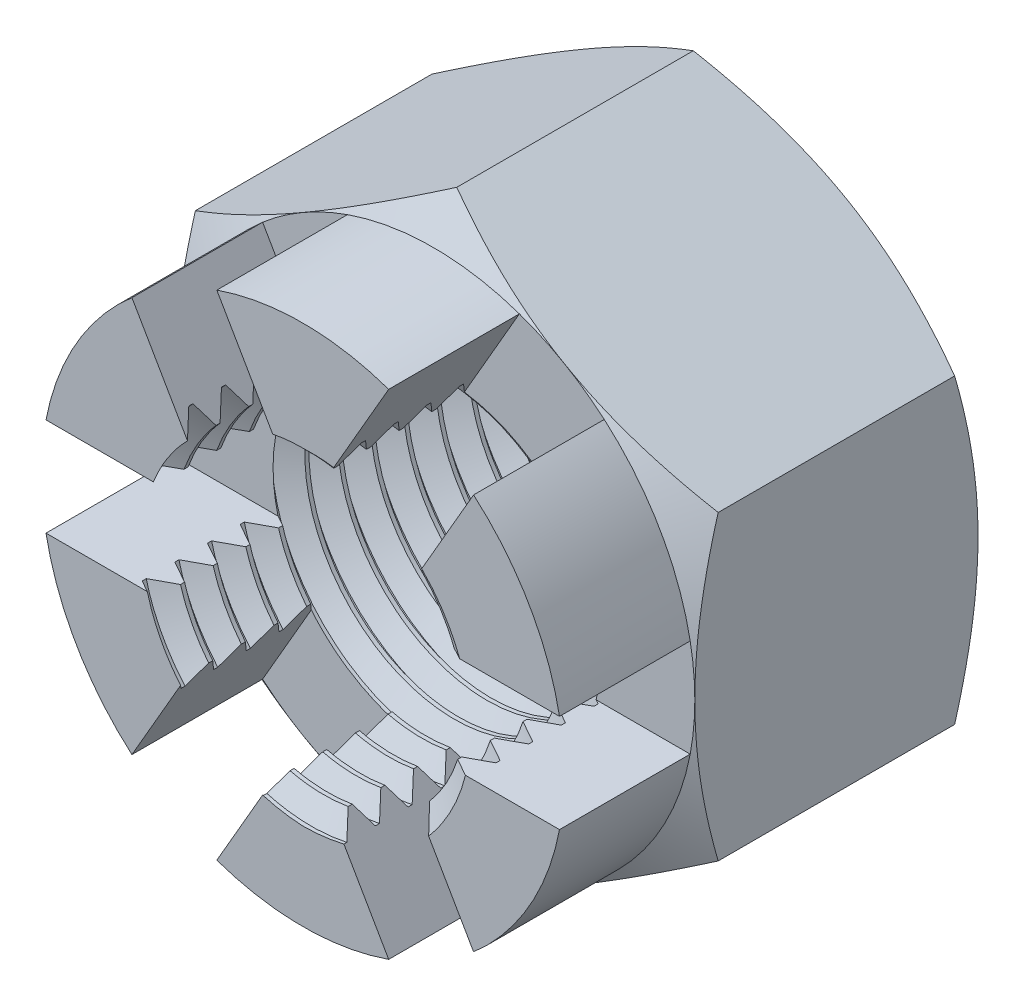
from build123d import *

# Parameters (mm, degrees)
EXTRUDE1_DEPTH      = 19
SKETCH3_OUTSIDE_W   = 129.178
SKETCH3_OUTSIDE_H   = 132.89
SKETCH3_OUTSIDE_R   = 12
CUT_EXTRUDE2_DEPTH  = 27.400757565
CUT_EXTRUDE2_DRAFT  = -60
SKETCH4_R           = 8
CUT_EXTRUDE3_DEPTH  = 27.400757565
CUT_EXTRUDE8_DEPTH  = 6
SKETCH14_OUTSIDE_W  = 115.568
SKETCH14_OUTSIDE_H  = 119.28
SKETCH14_OUTSIDE_R  = 12
CUT_EXTRUDE9_DEPTH  = 23.472205054
CUT_EXTRUDE9_DRAFT  = -60
SKETCH15_OUTSIDE_W  = 34.258
SKETCH15_OUTSIDE_H  = 37.97
SKETCH15_OUTSIDE_R  = 12
CUT_EXTRUDE10_DEPTH = 6
CIRPATTERN2_COUNT   = 6
SKETCH12_R          = 8
SKETCH12_R_2        = 7.025721421
EXTRUDE2_DEPTH      = 19
CUT_SWEEP1_PITCH    = 1.5
BOSS_EXTRUDE1_START = -0.1
SKETCH16_R          = 8.1
SKETCH16_R_2        = 8
BOSS_EXTRUDE1_DEPTH = 0.1
CUT_EXTRUDE11_DEPTH = 6
CIRPATTERN3_COUNT   = 6


with BuildPart() as part:
    # Sketch1 → Extrude1 (new body)
    with BuildSketch(Plane.XY):
        Polygon((0, 13.856406461), (-12, 6.92820323), (-12, -6.92820323), (0, -13.856406461), (12, -6.92820323), (12, 6.92820323), align=None)
    extrude(amount=-EXTRUDE1_DEPTH)


with BuildPart() as cut_extrude2_tool:
    # Sketch3 outside → Cut-Extrude2 (with draft: the straight prism first)
    with BuildSketch(Plane(origin=(0, 0, -19), x_dir=(-1, 0, 0), z_dir=(0, 0, -1))):
        Rectangle(SKETCH3_OUTSIDE_W, SKETCH3_OUTSIDE_H)
        Circle(SKETCH3_OUTSIDE_R, mode=Mode.SUBTRACT)
    extrude(amount=-CUT_EXTRUDE2_DEPTH)
    # Cut-Extrude2: the draft: its side faces are tilted about the plane it starts from
    cut_extrude2_sides = [cut_extrude2_tool.faces().sort_by_distance(p)[0] for p in [
        (0, -66.445, -5.299621218),
        (-64.589, 0, -5.299621218),
        (0, 66.445, -5.299621218),
        (64.589, 0, -5.299621218),
        (12, 0, -5.299621218),
    ]]
    draft(cut_extrude2_sides, Plane(origin=(0, 0, -19), x_dir=(-1, 0, 0), z_dir=(0, 0, -1)), CUT_EXTRUDE2_DRAFT)


with BuildPart() as part_1:
    add(part.part)

    # Cut-Extrude2: cut by cut_extrude2_tool
    add(cut_extrude2_tool.part, mode=Mode.SUBTRACT)

    # Sketch4 → Cut-Extrude3 (cut, through all)
    with BuildSketch(Plane.XY):
        Circle(SKETCH4_R)
    extrude(amount=-CUT_EXTRUDE3_DEPTH, mode=Mode.SUBTRACT)

    # Sketch13 → Cut-Extrude8 (cut)
    with BuildSketch(Plane.XY):
        Polygon((-1.948557159, 1.125), (1.948557159, -1.125), (7.948557159, 9.267304845), (4.051442841, 11.517304845), align=None)
    cut_extrude8 = extrude(amount=-CUT_EXTRUDE8_DEPTH, mode=Mode.SUBTRACT)


with BuildPart() as cut_extrude9_tool:
    # Sketch14 outside → Cut-Extrude9 (with draft: the straight prism first)
    with BuildSketch(Plane.XY.offset(-6)):
        Rectangle(SKETCH14_OUTSIDE_W, SKETCH14_OUTSIDE_H)
        Circle(SKETCH14_OUTSIDE_R, mode=Mode.SUBTRACT)
    extrude(amount=-CUT_EXTRUDE9_DEPTH)
    # Cut-Extrude9: the draft: its side faces are tilted about the plane it starts from
    cut_extrude9_sides = [cut_extrude9_tool.faces().sort_by_distance(p)[0] for p in [
        (0, -59.64, -17.736102527),
        (57.784, 0, -17.736102527),
        (0, 59.64, -17.736102527),
        (-57.784, 0, -17.736102527),
        (-12, 0, -17.736102527),
    ]]
    draft(cut_extrude9_sides, Plane.XY.offset(-6), CUT_EXTRUDE9_DRAFT)


with BuildPart() as part_2:
    add(part_1.part)

    # Cut-Extrude9: cut by cut_extrude9_tool
    add(cut_extrude9_tool.part, mode=Mode.SUBTRACT)

    # Sketch15 outside → Cut-Extrude10 (cut)
    with BuildSketch(Plane.XY):
        Rectangle(SKETCH15_OUTSIDE_W, SKETCH15_OUTSIDE_H)
        Circle(SKETCH15_OUTSIDE_R, mode=Mode.SUBTRACT)
    extrude(amount=-CUT_EXTRUDE10_DEPTH, mode=Mode.SUBTRACT)

    # CirPattern2: Cut-Extrude8 ×6 about axis
    cirpattern2_axis = Axis((0, 0, 0), (0, 0, 1))
    for i in range(1, CIRPATTERN2_COUNT):
        add(cut_extrude8.rotate(cirpattern2_axis, i * 360 / CIRPATTERN2_COUNT), mode=Mode.SUBTRACT)



with BuildPart() as body_2:
    # Sketch12 → Extrude2 (new body)
    with BuildSketch(Plane.XY):
        Circle(SKETCH12_R)
        Circle(SKETCH12_R_2, mode=Mode.SUBTRACT)
    extrude(amount=-EXTRUDE2_DEPTH)

    # Cut-Sweep1: the profile of Sketch9 profile screwed along a right-hand helix of 13.666667 turns, 6 arcs to a turn; built about Z, then put on its axis
    cut_sweep1_z = Axis((0, 0, 0), (0, 0, 1))
    cut_sweep1_corners = [(8.0003, 0, -0.749826795), (8.0003, 0, -0.562673205), (7.025721421, 0, 0), (7.025721421, 0, -1.3125)]
    with BuildLine(mode=Mode.PRIVATE) as cut_sweep1_profile:
        Line(cut_sweep1_corners[0], cut_sweep1_corners[1])
        Line(cut_sweep1_corners[1], cut_sweep1_corners[2])
        Line(cut_sweep1_corners[2], cut_sweep1_corners[3])
        Line(cut_sweep1_corners[3], cut_sweep1_corners[0])
    cut_sweep1_cap = Face(cut_sweep1_profile.wire())
    cut_sweep1_turn_angles = [0, 30, 60, 90, 120, 150, 180, 210, 240, 270, 300, 330, 360]
    cut_sweep1_turn_weights = [1, 0.8660254037844387, 1, 0.8660254037844387, 1, 0.8660254037844387, 1, 0.8660254037844387, 1, 0.8660254037844387, 1, 0.8660254037844387, 1]
    cut_sweep1_turn_rails = [Edge.make_bspline([Vector(p[0], p[1], 0).rotate(cut_sweep1_z, cut_sweep1_turn_angles[k]) / cut_sweep1_turn_weights[k] + Vector(0, 0, p[2] + CUT_SWEEP1_PITCH * cut_sweep1_turn_angles[k] / 360) for k in range(13)], [0, 0, 0, 1, 1, 2, 2, 3, 3, 4, 4, 5, 5, 6, 6, 6], 2, cut_sweep1_turn_weights) for p in cut_sweep1_corners]
    cut_sweep1_turn_sides = [Face.make_surface_from_curves(cut_sweep1_turn_rails[p[0]], cut_sweep1_turn_rails[p[1]]) for p in [(0, 1), (1, 2), (2, 3), (3, 0)]]
    cut_sweep1_last_angles = [4680, 4710, 4740, 4770, 4800, 4830, 4860, 4890, 4920]
    cut_sweep1_last_weights = [1, 0.8660254037844387, 1, 0.8660254037844387, 1, 0.8660254037844387, 1, 0.8660254037845061, 1]
    cut_sweep1_last_rails = [Edge.make_bspline([Vector(p[0], p[1], 0).rotate(cut_sweep1_z, cut_sweep1_last_angles[k]) / cut_sweep1_last_weights[k] + Vector(0, 0, p[2] + CUT_SWEEP1_PITCH * cut_sweep1_last_angles[k] / 360) for k in range(9)], [0, 0, 0, 1, 1, 2, 2, 3, 3, 4, 4, 4], 2, cut_sweep1_last_weights) for p in cut_sweep1_corners]
    cut_sweep1_last_sides = [Face.make_surface_from_curves(cut_sweep1_last_rails[p[0]], cut_sweep1_last_rails[p[1]]) for p in [(0, 1), (1, 2), (2, 3), (3, 0)]]
    cut_sweep1 = Plane(origin=(0, 0, 0), x_dir=(0, 1, 0), z_dir=(0, 0, -1)) * Solid(Shell([*[p.moved(Location((0, 0, CUT_SWEEP1_PITCH * i))) for i in range(13) for p in cut_sweep1_turn_sides], *cut_sweep1_last_sides, cut_sweep1_cap, cut_sweep1_cap.rotate(cut_sweep1_z, 4920).moved(Location((0, 0, CUT_SWEEP1_PITCH * 4920 / 360)))]))
    add(cut_sweep1, mode=Mode.SUBTRACT)


with BuildPart() as part_3:
    add(part_2.part)

    add(body_2.part)  # Boss-Extrude1 merges body 2
    # Sketch16 → Boss-Extrude1 (add)
    with BuildSketch(Plane(origin=(0, 0, -19), x_dir=(-1, 0, 0), z_dir=(0, 0, -1)).offset(BOSS_EXTRUDE1_START)):
        Circle(SKETCH16_R)
        Circle(SKETCH16_R_2, mode=Mode.SUBTRACT)
    extrude(amount=BOSS_EXTRUDE1_DEPTH)

    # Sketch17 → Cut-Extrude11 (cut)
    with BuildSketch(Plane.XY):
        Polygon((-1.948557159, 1.125), (1.948557159, -1.125), (7.948557159, 9.267304845), (4.051442841, 11.517304845), align=None)
    cut_extrude11 = extrude(amount=-CUT_EXTRUDE11_DEPTH, mode=Mode.SUBTRACT)

    # CirPattern3: Cut-Extrude11 ×6 about axis
    cirpattern3_axis = Axis((0, 0, -41.627416998), (0, 0, 1))
    for i in range(1, CIRPATTERN3_COUNT):
        add(cut_extrude11.rotate(cirpattern3_axis, i * 360 / CIRPATTERN3_COUNT), mode=Mode.SUBTRACT)


solid = part_3.part
